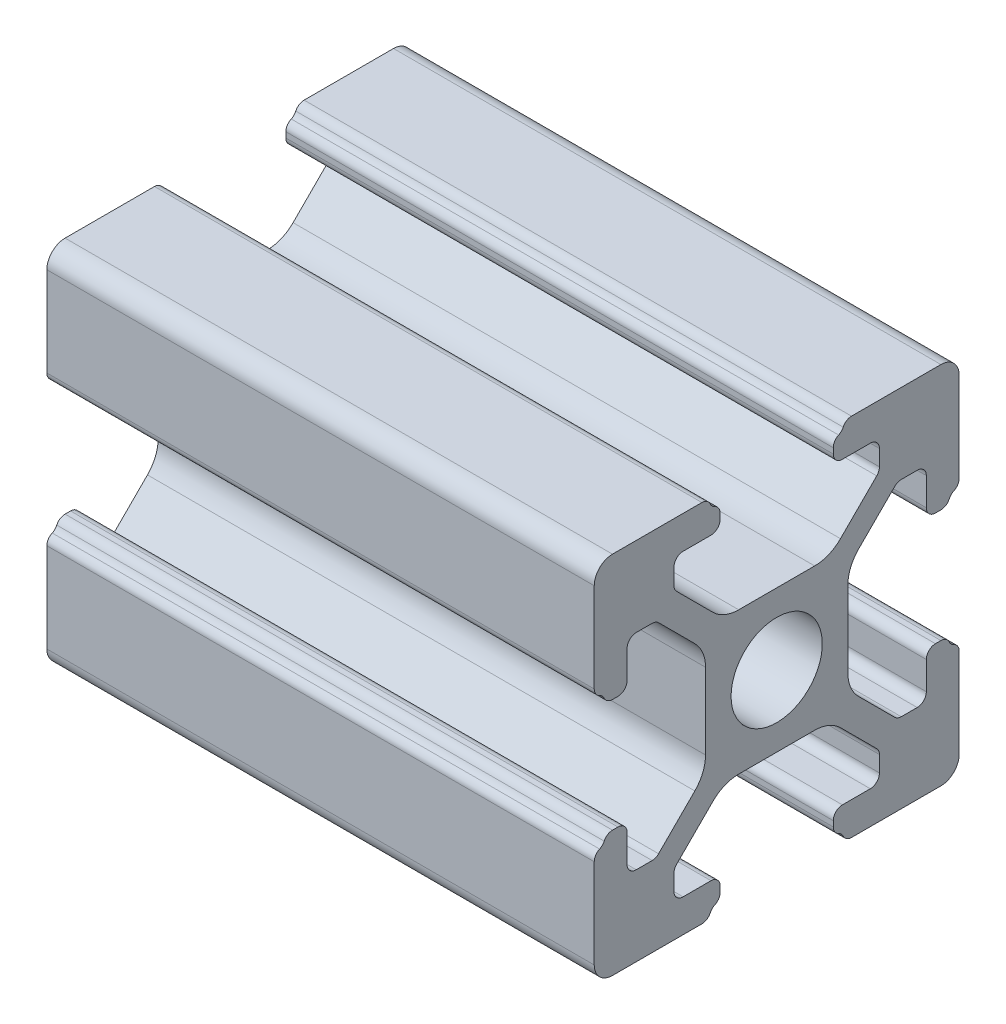
from build123d import *

# Parameters (mm, degrees)
SKETCH1_W                = 20
SKETCH1_H                = 20
BOSS_EXTRUDE1_DEPTH      = 30
FILLET1_R                = 1
CUT_EXTRUDE1_DEPTH       = 34.166247904
F_5_0_5_DIAMETER_HOLE1_D = 5
FILLET2_R                = 2
FILLET3_R                = 0.5
FILLET4_R                = 0.5
FILLET5_R                = 0.5


with BuildPart() as part:
    # Sketch1 → Boss-Extrude1 (new body)
    with BuildSketch(Plane(origin=(0, 0, 0), x_dir=(0, 0, -1), z_dir=(1, 0, 0))):
        Rectangle(SKETCH1_W, SKETCH1_H)
    extrude(amount=BOSS_EXTRUDE1_DEPTH)

    # Fillet1
    fillet1_edges = [part.edges().sort_by_distance(p)[0] for p in [
        (15, 10, 10),
        (15, 10, -10),
        (15, -10, -10),
        (15, -10, 10),
    ]]
    fillet(fillet1_edges, radius=FILLET1_R)

    # Sketch3 → Cut-Extrude1 (cut, through all)
    with BuildSketch(Plane.ZY):
        Polygon((-3.6, 10), (3.6, 10), (3.6, 9.5), (3.1, 9.5), (3.1, 8.2), (5.63, 8.2), (5.63, 6.619949494), (2.910050506, 3.9), (-2.910050506, 3.9), (-5.63, 6.619949494), (-5.63, 8.2), (-3.1, 8.2), (-3.1, 9.5), (-3.6, 9.5), align=None)
        Polygon((10, 3.6), (10, -3.6), (9.5, -3.6), (9.5, -3.1), (8.2, -3.1), (8.2, -5.63), (6.619949494, -5.63), (3.9, -2.910050506), (3.9, 2.910050506), (6.619949494, 5.63), (8.2, 5.63), (8.2, 3.1), (9.5, 3.1), (9.5, 3.6), align=None)
        Polygon((3.6, -10), (-3.6, -10), (-3.6, -9.5), (-3.1, -9.5), (-3.1, -8.2), (-5.63, -8.2), (-5.63, -6.619949494), (-2.910050506, -3.9), (2.910050506, -3.9), (5.63, -6.619949494), (5.63, -8.2), (3.1, -8.2), (3.1, -9.5), (3.6, -9.5), align=None)
        Polygon((-10, -3.6), (-10, 3.6), (-9.5, 3.6), (-9.5, 3.1), (-8.2, 3.1), (-8.2, 5.63), (-6.619949494, 5.63), (-3.9, 2.910050506), (-3.9, -2.910050506), (-6.619949494, -5.63), (-8.2, -5.63), (-8.2, -3.1), (-9.5, -3.1), (-9.5, -3.6), align=None)
    extrude(amount=-CUT_EXTRUDE1_DEPTH, mode=Mode.SUBTRACT)

    # Ø5.0 (5) Diameter Hole1 (through all)
    with Locations(Plane.ZY):
        with Locations((0, 0)):
            Hole(F_5_0_5_DIAMETER_HOLE1_D / 2)

    # Fillet2
    fillet2_edges = [part.edges().sort_by_distance(p)[0] for p in [
        (15, -3.9, -2.910050506),
        (15, -3.9, 2.910050506),
        (15, 2.910050506, -3.9),
        (15, -2.910050506, -3.9),
        (15, -2.910050506, 3.9),
        (15, 2.910050506, 3.9),
        (15, 3.9, 2.910050506),
        (15, 3.9, -2.910050506),
    ]]
    fillet(fillet2_edges, radius=FILLET2_R)

    # Fillet3
    fillet3_edges = [part.edges().sort_by_distance(p)[0] for p in [
        (15, 3.6, -10),
        (15, 3.1, -9.5),
        (15, 3.1, -8.2),
        (15, 5.63, -8.2),
        (15, 5.63, -6.619949494),
        (15, 3.6, 10),
        (15, 3.1, 9.5),
        (15, 3.1, 8.2),
        (15, 5.63, 8.2),
        (15, 5.63, 6.619949494),
        (15, 6.619949494, 5.63),
        (15, 8.2, 5.63),
        (15, 8.2, 3.1),
        (15, 9.5, 3.1),
        (15, 10, 3.6),
        (15, 9.5, -3.1),
        (15, 10, -3.6),
        (15, 8.2, -3.1),
        (15, 8.2, -5.63),
        (15, 6.619949494, -5.63),
    ]]
    fillet(fillet3_edges, radius=FILLET3_R - 0.0001)  # a hair under: the kernel refuses the full size

    # Fillet4
    fillet4_edges = [part.edges().sort_by_distance(p)[0] for p in [
        (15, -3.6, 10),
        (15, -3.1, 9.5),
        (15, -3.1, 8.2),
        (15, -5.63, 8.2),
        (15, -5.63, 6.619949494),
        (15, -6.619949494, 5.63),
        (15, -8.2, 5.63),
        (15, -8.2, 3.1),
        (15, -10, 3.6),
        (15, -9.5, 3.1),
        (15, -10, -3.6),
        (15, -9.5, -3.1),
        (15, -8.2, -3.1),
        (15, -8.2, -5.63),
        (15, -6.619949494, -5.63),
        (15, -5.63, -6.619949494),
        (15, -5.63, -8.2),
        (15, -3.1, -8.2),
        (15, -3.1, -9.5),
        (15, -3.6, -10),
    ]]
    fillet(fillet4_edges, radius=FILLET4_R - 0.0001)  # a hair under: the kernel refuses the full size

    # Fillet5
    fillet5_edges = [part.edges().sort_by_distance(p)[0] for p in [
        (15, 3.6, 9.5),
        (15, 9.5, 3.6),
        (15, 9.5, -3.6),
        (15, 3.6, -9.5),
        (15, -3.6, 9.5),
        (15, -9.5, 3.6),
        (15, -9.5, -3.6),
        (15, -3.6, -9.5),
    ]]
    fillet(fillet5_edges, radius=FILLET5_R)


solid = part.part
